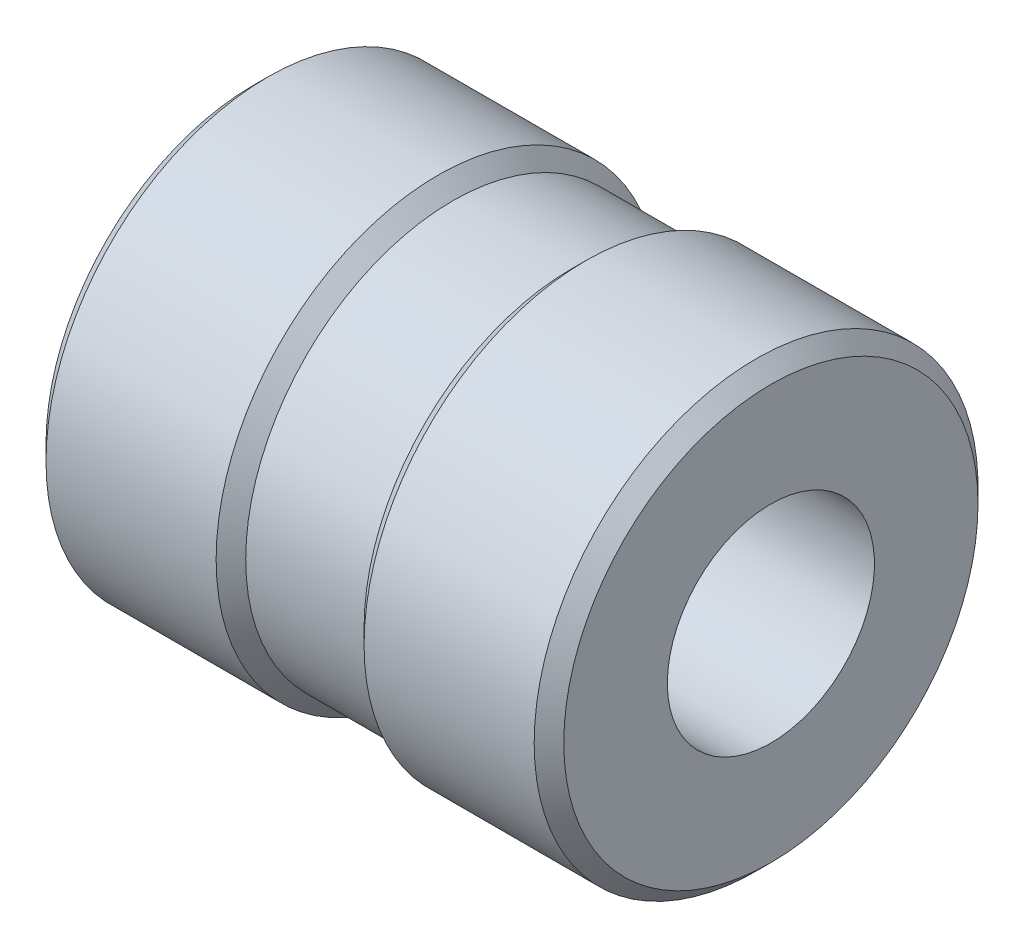
from build123d import *

# Parameters (mm, degrees)
SFAZOWANIE1_SIZE = 1


with BuildPart() as part:
    # Szkic1 → Obrót1 (revolve)
    with BuildSketch(Plane.XY, mode=Mode.PRIVATE) as obr_t1_sk:
        Polygon((-17.5, 15), (-17.5, 7), (-3.5, 7), (-3.5, 2), (3.5, 2), (3.5, 7), (17.5, 7), (17.5, 15), (4, 15), (4, 14), (-4, 14), (-4, 15), align=None)
    revolve(obr_t1_sk.sketch.rotate(Axis((0, 0, 0), (1, 0, 0)), 90), axis=Axis((0, 0, 0), (1, 0, 0)))

    # Sfazowanie1
    sfazowanie1_edges = [part.edges().sort_by_distance(p)[0] for p in [
        (4, 0, -15),
        (17.5, 0, -15),
        (-17.5, 0, -15),
        (-4, 0, -15),
    ]]
    chamfer(sfazowanie1_edges, length=SFAZOWANIE1_SIZE - 0.0001)  # a hair under: the kernel refuses the full size


solid = part.part
